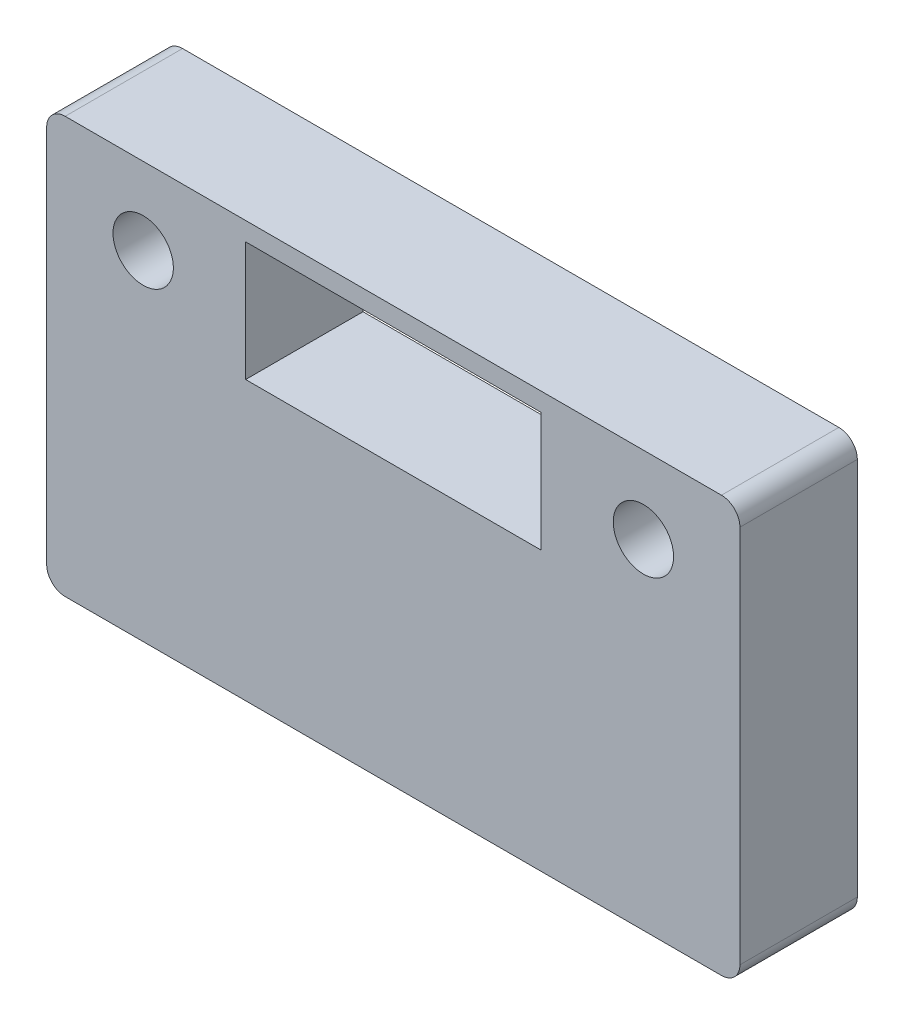
from build123d import *

# Parameters (mm, degrees)
SKETCH1_W                                        = 75
SKETCH1_H                                        = 45
BOSS_EXTRUDE1_DEPTH                              = 12.7
CSK_FOR_1_4_FLAT_HEAD_MACHINE_SCREW2_D           = 6.5278
CSK_FOR_1_4_FLAT_HEAD_MACHINE_SCREW2_CSINK_D     = 12.8778
CSK_FOR_1_4_FLAT_HEAD_MACHINE_SCREW2_CSINK_ANGLE = 82
FILLET1_R                                        = 2
FILLET2_R                                        = 2


with BuildPart() as part:
    # Sketch1 → Boss-Extrude1 (new body)
    with BuildSketch(Plane.XY):
        with Locations((37.5, -22.5)):
            Rectangle(SKETCH1_W, SKETCH1_H)
        Polygon((37.5, -2), (53.475, -2), (53.475, -14.9), (21.525, -14.9), (21.525, -2), align=None, mode=Mode.SUBTRACT)
    extrude(amount=BOSS_EXTRUDE1_DEPTH)

    # CSK for 1/4 Flat Head Machine Screw2 (through all)
    with Locations(Plane(origin=(0, 0, 0), x_dir=(-1, 0, 0), z_dir=(0, 0, -1))):
        with Locations((-64.56, -8.35), (-10.44, -8.35)):
            CounterSinkHole(CSK_FOR_1_4_FLAT_HEAD_MACHINE_SCREW2_D / 2, CSK_FOR_1_4_FLAT_HEAD_MACHINE_SCREW2_CSINK_D / 2, counter_sink_angle=CSK_FOR_1_4_FLAT_HEAD_MACHINE_SCREW2_CSINK_ANGLE)

    # Fillet1
    fillet1_edges = [part.edges().sort_by_distance(p)[0] for p in [
        (0, 0, 6.35),
        (0, -45, 6.35),
    ]]
    fillet(fillet1_edges, radius=FILLET1_R)

    # Fillet2
    fillet2_edges = [part.edges().sort_by_distance(p)[0] for p in [
        (75, -45, 6.35),
        (75, 0, 6.35),
    ]]
    fillet(fillet2_edges, radius=FILLET2_R)


solid = part.part
